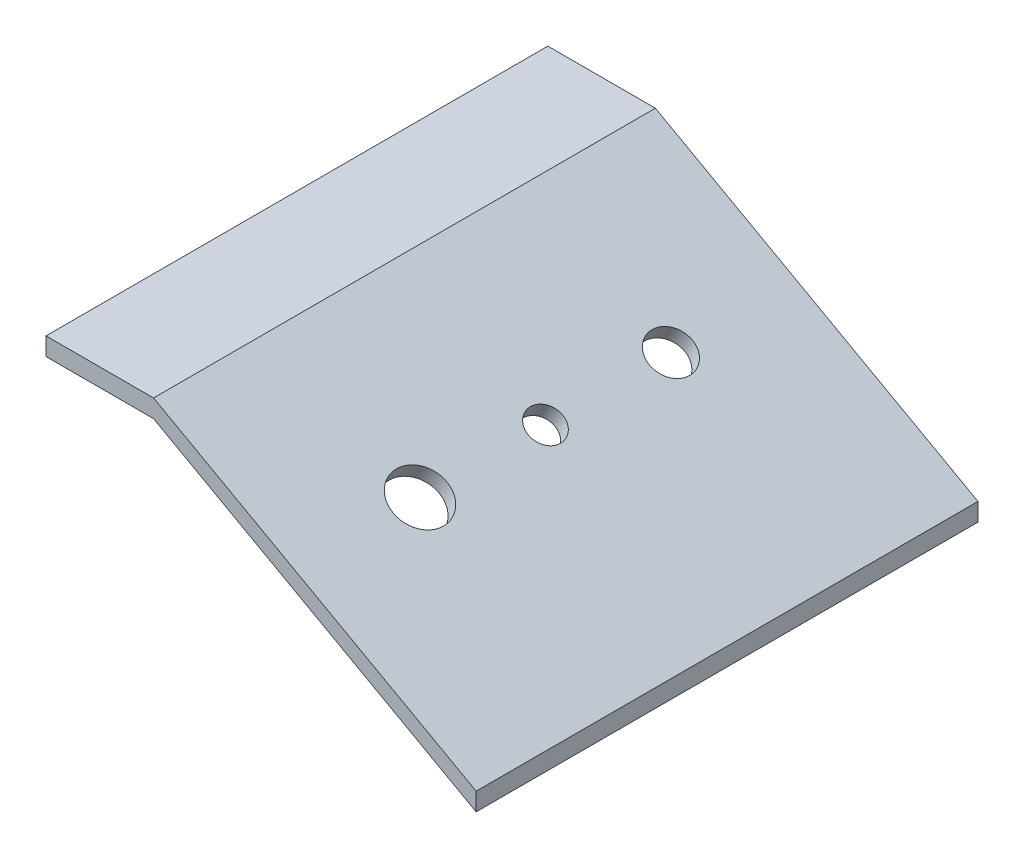
from build123d import *

# Parameters (mm, degrees)
BOSS_EXTRUDE1_DEPTH = 152.4
SKETCH2_R           = 9.525
SKETCH2_R_2         = 6.096
SKETCH2_R_3         = 7.62
CUT_EXTRUDE1_DEPTH  = 152.4
SKETCH3_R           = 3.175
BOSS_EXTRUDE2_DEPTH = 12.7
SKETCH4_R           = 3.175
BOSS_EXTRUDE3_DEPTH = 12.7
BOSS_EXTRUDE5_DEPTH = 12.7
BOSS_EXTRUDE6_DEPTH = 12.7


with BuildPart() as part:
    # Sketch1 → Boss-Extrude1 (new body)
    with BuildSketch(Plane.XY):
        Polygon((0, 0), (38.1, 0), (152.4, -63.5), (152.4, -57.15), (38.1, 6.35), (0, 6.35), align=None)
    extrude(amount=BOSS_EXTRUDE1_DEPTH)

    # Sketch2 → Cut-Extrude1 (cut)
    with BuildSketch(Plane(origin=(11.681603774, 21.026886792, 0), x_dir=(0.8741572761215379, -0.48564293117863194, 0), z_dir=(0.4856429311786319, 0.8741572761215378, 0))):
        with Locations((87.371559607, -120.65)):
            Circle(SKETCH2_R)
        with Locations((87.371559607, -76.2)):
            Circle(SKETCH2_R_2)
        with Locations((87.371559607, -31.75)):
            Circle(SKETCH2_R_3)
    extrude(amount=-CUT_EXTRUDE1_DEPTH, mode=Mode.SUBTRACT)

    # Sketch3 → Boss-Extrude2 (add)
    with BuildSketch(Plane.XZ):
        with Locations((12.7, 6.35)):
            Circle(SKETCH3_R)
        with Locations((12.7, 146.05)):
            Circle(SKETCH3_R)
    extrude(amount=BOSS_EXTRUDE2_DEPTH)

    # Sketch4 → Boss-Extrude3 (add)
    with BuildSketch(Plane(origin=(8.985849057, 16.174528302, 0), x_dir=(0.8741572761215378, -0.48564293117863205, 0), z_dir=(-0.4856429311786321, -0.8741572761215379, 0))):
        with Locations((151.359895011, 6.35)):
            Circle(SKETCH4_R)
        with Locations((151.359895011, 146.05)):
            Circle(SKETCH4_R)
    extrude(amount=BOSS_EXTRUDE3_DEPTH)

    # Sketch7 → Boss-Extrude5 (add)
    with BuildSketch(Plane.XY.offset(152.4)):
        Polygon((0, 0), (0, 6.35), (38.1, 6.35), (152.4, -57.15), (152.4, -63.5), (38.1, 0), align=None)
    extrude(amount=BOSS_EXTRUDE5_DEPTH)

    # Sketch8 → Boss-Extrude6 (add)
    with BuildSketch(Plane(origin=(0, 0, 0), x_dir=(-1, 0, 0), z_dir=(0, 0, -1))):
        Polygon((0, 0), (-38.1, 0), (-152.4, -63.5), (-152.4, -57.15), (-38.1, 6.35), (0, 6.35), align=None)
    extrude(amount=BOSS_EXTRUDE6_DEPTH)


solid = part.part
